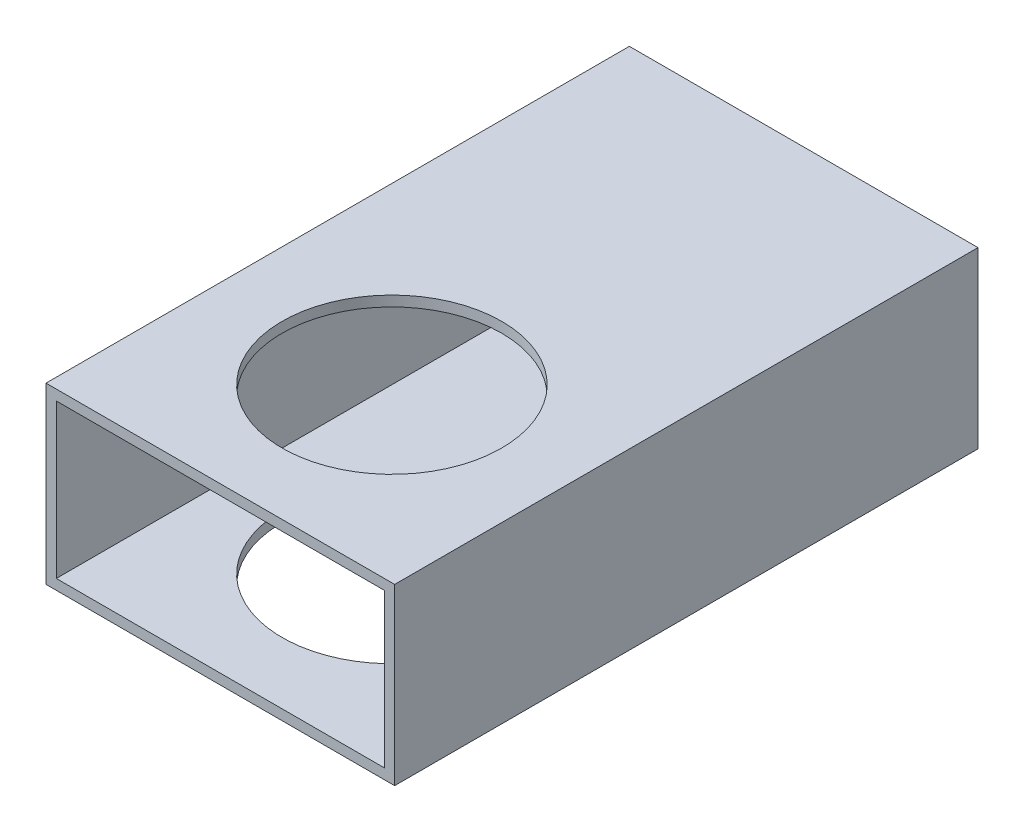
from build123d import *

# Parameters (mm, degrees)
CROQUIS1_W              = 50.8
CROQUIS1_H              = 25.4
CROQUIS1_W_2            = 47.8
CROQUIS1_H_2            = 22.4
SALIENTE_EXTRUIR1_DEPTH = 85
CROQUIS2_R              = 16
CORTAR_EXTRUIR1_DEPTH   = 26


with BuildPart() as part:
    # Croquis1 → Saliente-Extruir1 (new body)
    with BuildSketch(Plane.XY):
        Rectangle(CROQUIS1_W, CROQUIS1_H)
        Rectangle(CROQUIS1_W_2, CROQUIS1_H_2, mode=Mode.SUBTRACT)
    extrude(amount=SALIENTE_EXTRUIR1_DEPTH)

    # Croquis2 → Cortar-Extruir1 (cut)
    with BuildSketch(Plane(origin=(0, -12.7, 0), x_dir=(-1, 0, 0), z_dir=(0, -1, 0))):
        with Locations((0, -60)):
            Circle(CROQUIS2_R)
    extrude(amount=-CORTAR_EXTRUIR1_DEPTH, mode=Mode.SUBTRACT)


solid = part.part
